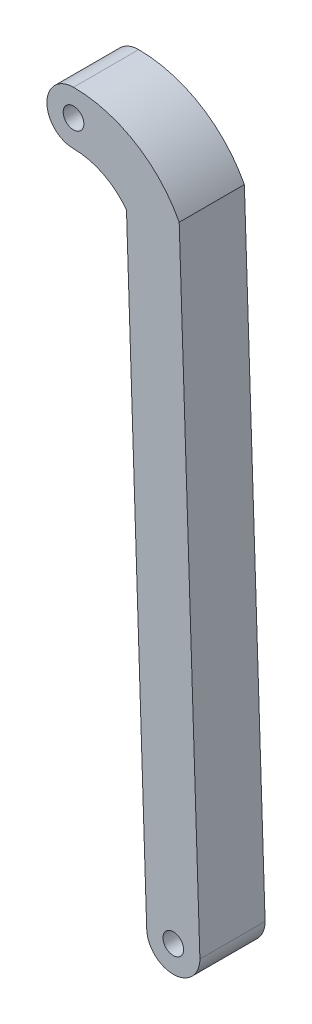
from build123d import *

# Parameters (mm, degrees)
BOSS_EXTRU_1_DEPTH      = 4.9
BOSS_EXTRU_1_DEPTH_BACK = 4.9
ESQUISSE1_R             = 1.55


with BuildPart() as part:
    # Esquisse1 → Boss.-Extru.1 (new, two sides: drawn at the far end of the back side and taken through both)
    with BuildSketch(Plane.XY.offset(-BOSS_EXTRU_1_DEPTH_BACK)):
        with BuildLine():
            Line((-7.035134666, 91.99317437), (-4, 0))
            ThreePointArc((-4, 0), (0, -4), (4, 0))
            Line((4, 0), (0.886406153, 94.37122672))
            ThreePointArc((0.886406153, 94.37122672), (-5.711685092, 101.40489844), (-15, 104))
            ThreePointArc((-15, 104), (-19, 100), (-15, 96))
            ThreePointArc((-15, 96), (-10.542037141, 94.941857654), (-7.035134666, 91.99317437))
        make_face()
        Circle(ESQUISSE1_R, mode=Mode.SUBTRACT)
        with Locations((-15, 100)):
            Circle(ESQUISSE1_R, mode=Mode.SUBTRACT)
    extrude(amount=BOSS_EXTRU_1_DEPTH + BOSS_EXTRU_1_DEPTH_BACK)


solid = part.part
